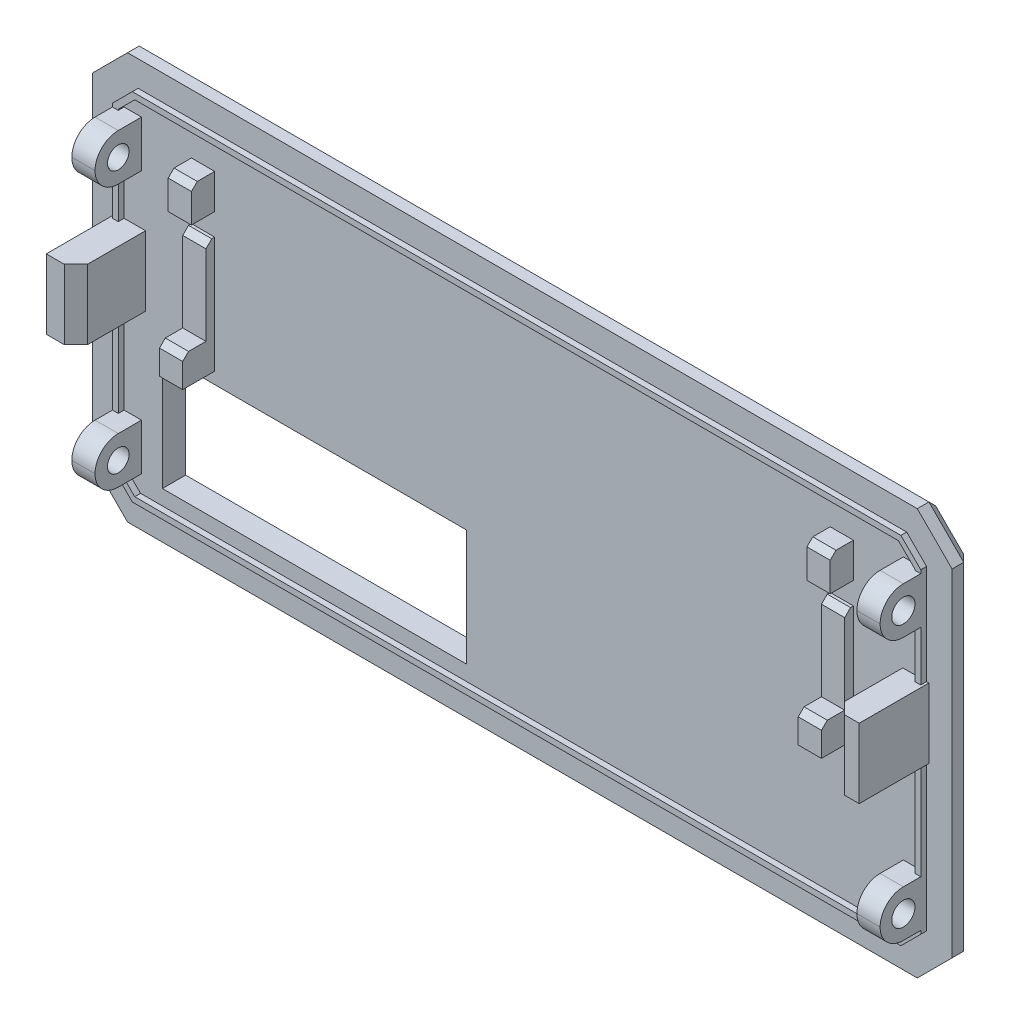
from build123d import *

# Parameters (mm, degrees)
EXTRUDE_1_DEPTH               = 2
CHAMFER_1_SIZE                = 1
SKETCH_3_W                    = 2
SKETCH_3_H                    = 4
EXTRUDE_2_DEPTH               = 4
FILLET_1_R                    = 2
SKETCH_4_R                    = 1
CUT_EXTRUDE_1_DEPTH           = 2
CUT_EXTRUDE_1_DRAFT           = -2
CUT_EXTRUDE_1_PROFILE_2_DEPTH = 2
CUT_EXTRUDE_1_PROFILE_2_DRAFT = -2
SKETCH_5_R                    = 1
CUT_EXTRUDE_2_DEPTH           = 2
CUT_EXTRUDE_2_DRAFT           = -2
CUT_EXTRUDE_2_PROFILE_2_DEPTH = 2
CUT_EXTRUDE_2_PROFILE_2_DRAFT = -2
SKETCH_6_W                    = 2
SKETCH_6_H                    = 10
EXTRUDE_3_DEPTH               = 0.75
SKETCH_7_W                    = 2
SKETCH_7_H                    = 2.6
EXTRUDE_4_DEPTH               = 2
CHAMFER_2_SIZE                = 0.5
SKETCH_8_W                    = 2.55
SKETCH_8_H                    = 6
SKETCH_8_W_2                  = 2.25
EXTRUDE_5_DEPTH               = 6
CHAMFER_3_SIZE                = 1
SKETCH_9_W                    = 2
SKETCH_9_H                    = 3
EXTRUDE_6_DEPTH               = 2
CHAMFER_4_SIZE                = 0.5
CUT_EXTRUDE_3_REACH           = 46.294
SKETCH_10_W                   = 26.2
SKETCH_10_H                   = 10
EXTRUDE_7_DEPTH               = 0.5


with BuildPart() as part:
    # 草图1 → 凸台-拉伸1 (new body)
    with BuildSketch(Plane.XY):
        Polygon((-39.76383505, 14.799206062), (-36.76383505, 17.799206062), (31.23616495, 17.799206062), (34.23616495, 14.799206062), (34.23616495, -14.200793938), (31.23616495, -17.200793938), (-36.76383505, -17.200793938), (-39.76383505, -14.200793938), align=None)
    extrude(amount=EXTRUDE_1_DEPTH)

    # 倒角1
    chamfer_1_edges = [part.edges().sort_by_distance(p)[0] for p in [
        (-38.26383505, -15.700793938, 0),
        (-39.76383505, 0.299206062, 0),
        (-38.26383505, 16.299206062, 0),
        (-2.76383505, 17.799206062, 0),
        (32.73616495, 16.299206062, 0),
        (34.23616495, 0.299206062, 0),
        (32.73616495, -15.700793938, 0),
        (-2.76383505, -17.200793938, 0),
    ]]
    chamfer(chamfer_1_edges, length=CHAMFER_1_SIZE)

    # 草图3 → 凸台-拉伸2 (add)
    with BuildSketch(Plane.XY.offset(2)):
        with Locations((-36.56383505, 11.599206062)):
            Rectangle(SKETCH_3_W, SKETCH_3_H)
        with Locations((-36.56383505, -11.000793938)):
            Rectangle(SKETCH_3_W, SKETCH_3_H)
        with Locations((31.03616495, 11.599206062)):
            Rectangle(SKETCH_3_W, SKETCH_3_H)
        with Locations((31.03616495, -11.000793938)):
            Rectangle(SKETCH_3_W, SKETCH_3_H)
    extrude(amount=EXTRUDE_2_DEPTH)

    # 圆角1
    fillet_1_edges = [part.edges().sort_by_distance(p)[0] for p in [
        (31.03616495, 13.599206062, 6),
        (31.03616495, 9.599206062, 6),
        (31.03616495, -9.000793938, 6),
        (31.03616495, -13.000793938, 6),
        (-36.56383505, -13.000793938, 6),
        (-36.56383505, -9.000793938, 6),
        (-36.56383505, 13.599206062, 6),
        (-36.56383505, 9.599206062, 6),
    ]]
    fillet(fillet_1_edges, radius=FILLET_1_R - 0.0001)  # a hair under: the kernel refuses the full size


with BuildPart() as cut_extrude_1_tool:
    # 草图4 → 切除-拉伸1 (with draft: the straight prism first)
    with BuildSketch(Plane(origin=(32.03616495, 0, 0), x_dir=(0, 0, -1), z_dir=(1, 0, 0))):
        with Locations((-4, 11.599206062)):
            Circle(SKETCH_4_R)
    extrude(amount=-CUT_EXTRUDE_1_DEPTH)
    # 切除-拉伸1: the draft: its side faces are tilted about the plane it starts from
    cut_extrude_1_sides = [cut_extrude_1_tool.faces().sort_by_distance(p)[0] for p in [
        (31.03616495, 11.599206062, 5),
    ]]
    draft(cut_extrude_1_sides, Plane(origin=(32.03616495, 0, 0), x_dir=(0, 0, -1), z_dir=(1, 0, 0)), CUT_EXTRUDE_1_DRAFT)


with BuildPart() as part_1:
    add(part.part)

    # 切除-拉伸1: cut by cut_extrude_1_tool
    add(cut_extrude_1_tool.part, mode=Mode.SUBTRACT)


with BuildPart() as cut_extrude_1_profile_2_tool:
    # 草图4 → 切除-拉伸1 profile 2 (with draft: the straight prism first)
    with BuildSketch(Plane(origin=(32.03616495, 0, 0), x_dir=(0, 0, -1), z_dir=(1, 0, 0))):
        with Locations((-4, -11.000793938)):
            Circle(SKETCH_4_R)
    extrude(amount=-CUT_EXTRUDE_1_PROFILE_2_DEPTH)
    # 切除-拉伸1 profile 2: the draft: its side faces are tilted about the plane it starts from
    cut_extrude_1_profile_2_sides = [cut_extrude_1_profile_2_tool.faces().sort_by_distance(p)[0] for p in [
        (31.03616495, -11.000793938, 5),
    ]]
    draft(cut_extrude_1_profile_2_sides, Plane(origin=(32.03616495, 0, 0), x_dir=(0, 0, -1), z_dir=(1, 0, 0)), CUT_EXTRUDE_1_PROFILE_2_DRAFT)


with BuildPart() as part_2:
    add(part_1.part)

    # 切除-拉伸1 profile 2: cut by cut_extrude_1_profile_2_tool
    add(cut_extrude_1_profile_2_tool.part, mode=Mode.SUBTRACT)


with BuildPart() as cut_extrude_2_tool:
    # 草图5 → 切除-拉伸2 (with draft: the straight prism first)
    with BuildSketch(Plane.ZY.offset(37.56383505)):
        with Locations((4, 11.599206062)):
            Circle(SKETCH_5_R)
    extrude(amount=-CUT_EXTRUDE_2_DEPTH)
    # 切除-拉伸2: the draft: its side faces are tilted about the plane it starts from
    cut_extrude_2_sides = [cut_extrude_2_tool.faces().sort_by_distance(p)[0] for p in [
        (-36.56383505, 11.599206062, 3),
    ]]
    draft(cut_extrude_2_sides, Plane.ZY.offset(37.56383505), CUT_EXTRUDE_2_DRAFT)


with BuildPart() as part_3:
    add(part_2.part)

    # 切除-拉伸2: cut by cut_extrude_2_tool
    add(cut_extrude_2_tool.part, mode=Mode.SUBTRACT)


with BuildPart() as cut_extrude_2_profile_2_tool:
    # 草图5 → 切除-拉伸2 profile 2 (with draft: the straight prism first)
    with BuildSketch(Plane.ZY.offset(37.56383505)):
        with Locations((4, -11.000793938)):
            Circle(SKETCH_5_R)
    extrude(amount=-CUT_EXTRUDE_2_PROFILE_2_DEPTH)
    # 切除-拉伸2 profile 2: the draft: its side faces are tilted about the plane it starts from
    cut_extrude_2_profile_2_sides = [cut_extrude_2_profile_2_tool.faces().sort_by_distance(p)[0] for p in [
        (-36.56383505, -11.000793938, 3),
    ]]
    draft(cut_extrude_2_profile_2_sides, Plane.ZY.offset(37.56383505), CUT_EXTRUDE_2_PROFILE_2_DRAFT)


with BuildPart() as part_4:
    add(part_3.part)

    # 切除-拉伸2 profile 2: cut by cut_extrude_2_profile_2_tool
    add(cut_extrude_2_profile_2_tool.part, mode=Mode.SUBTRACT)

    # 草图6 → 凸台-拉伸3 (add)
    with BuildSketch(Plane.XY.offset(2)):
        with Locations((-30.26383505, 2.799206062)):
            Rectangle(SKETCH_6_W, SKETCH_6_H)
        with Locations((24.73616495, 2.799206062)):
            Rectangle(SKETCH_6_W, SKETCH_6_H)
    extrude(amount=EXTRUDE_3_DEPTH)

    # 草图7 → 凸台-拉伸4 (add)
    with BuildSketch(Plane.XY.offset(2.75)):
        with Locations((-30.26383505, -0.900793938)):
            Rectangle(SKETCH_7_W, SKETCH_7_H)
        with Locations((24.73616495, -0.900793938)):
            Rectangle(SKETCH_7_W, SKETCH_7_H)
    extrude(amount=EXTRUDE_4_DEPTH)

    # 倒角2
    chamfer_2_edges = [part_4.edges().sort_by_distance(p)[0] for p in [
        (-30.26383505, 7.799206062, 2.75),
        (24.73616495, 7.799206062, 2.75),
        (-30.26383505, 0.399206062, 4.75),
        (24.73616495, 0.399206062, 4.75),
    ]]
    chamfer(chamfer_2_edges, length=CHAMFER_2_SIZE)

    # 草图8 → 凸台-拉伸5 (add)
    with BuildSketch(Plane.XY.offset(2)):
        with Locations((-36.48883505, 2.299206062)):
            Rectangle(SKETCH_8_W, SKETCH_8_H)
        with Locations((31.11116495, 2.299206062)):
            Rectangle(SKETCH_8_W_2, SKETCH_8_H)
    extrude(amount=EXTRUDE_5_DEPTH)

    # 倒角3
    chamfer_3_edges = [part_4.edges().sort_by_distance(p)[0] for p in [
        (-35.21383505, 2.299206062, 8),
        (29.98616495, 2.299206062, 8),
    ]]
    chamfer(chamfer_3_edges, length=CHAMFER_3_SIZE)

    # 草图9 → 凸台-拉伸6 (add)
    with BuildSketch(Plane.XY.offset(2)):
        with Locations((-30.26383505, 11.199206062)):
            Rectangle(SKETCH_9_W, SKETCH_9_H)
        with Locations((24.73616495, 11.199206062)):
            Rectangle(SKETCH_9_W, SKETCH_9_H)
    extrude(amount=EXTRUDE_6_DEPTH)

    # 倒角4
    chamfer_4_edges = [part_4.edges().sort_by_distance(p)[0] for p in [
        (-30.26383505, 12.699206062, 4),
        (24.73616495, 12.699206062, 4),
    ]]
    chamfer(chamfer_4_edges, length=CHAMFER_4_SIZE)

    # 草图10 → 切除-拉伸3 (cut, up to next)
    with BuildSketch(Plane(origin=(0, 0, 0), x_dir=(-1, 0, 0), z_dir=(0, 0, -1)), mode=Mode.PRIVATE) as cut_extrude_3_sk1:
        with Locations((20.66383505, -8.200793938)):
            Rectangle(SKETCH_10_W, SKETCH_10_H)
    cut_extrude_3_tool1 = extrude(cut_extrude_3_sk1.sketch, amount=-CUT_EXTRUDE_3_REACH, mode=Mode.PRIVATE) & part_4.part
    add(cut_extrude_3_tool1.solids().sort_by_distance((-20.663835, -8.200794, 0))[0], mode=Mode.SUBTRACT)

    # 草图11 → 凸台-拉伸7 (add)
    with BuildSketch(Plane.XY.offset(2)):
        Polygon((30.324895113, 15.599206062), (-35.852565213, 15.599206062), (-37.56383505, 13.887936224), (-37.56383505, -13.289524101), (-35.852565213, -15.000793938), (30.324895113, -15.000793938), (32.03616495, -13.289524101), (32.03616495, 13.887936224), align=None)
        Polygon((30.117788331, 15.099206062), (-35.645458432, 15.099206062), (-37.06383505, 13.680829443), (-37.06383505, -13.08241732), (-35.645458432, -14.500793938), (30.117788331, -14.500793938), (31.53616495, -13.08241732), (31.53616495, 13.680829443), align=None, mode=Mode.SUBTRACT)
    extrude(amount=EXTRUDE_7_DEPTH)


solid = part_4.part
